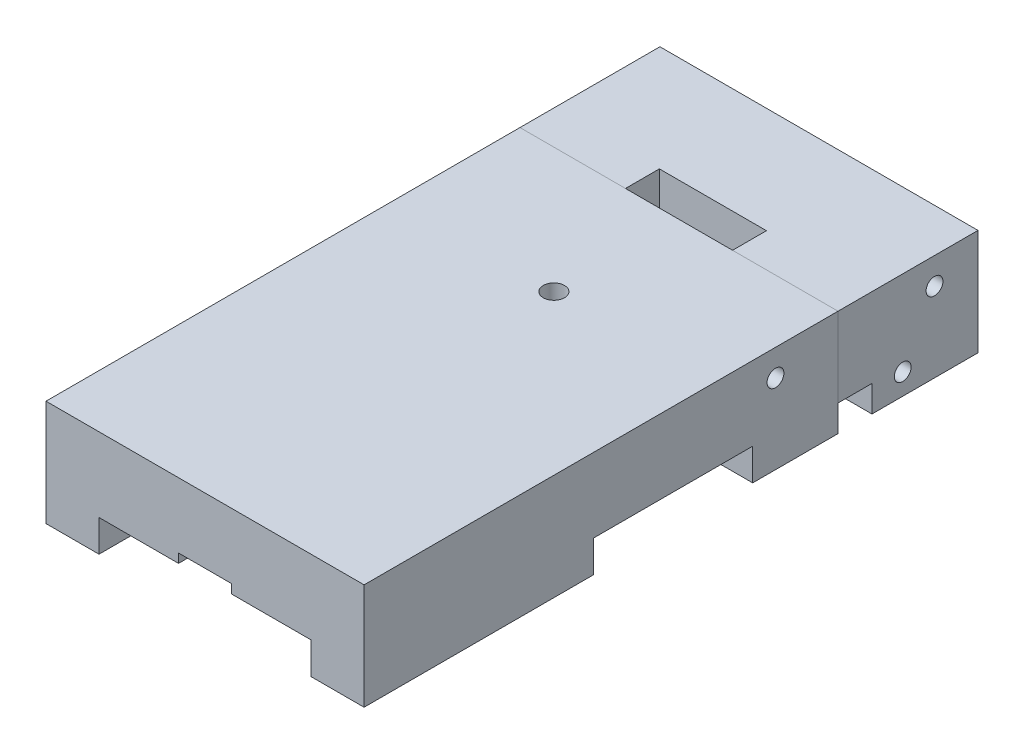
from build123d import *

# Parameters (mm, degrees)
BOSS_EXTRUDE1_DEPTH         = 12.7
BOSS_EXTRUDE1_DEPTH_BACK    = 12.7
SKETCH1_W                   = 76.2
SKETCH1_H                   = 147.066
SKETCH2_R                   = 4.7625
CUT_EXTRUDE1_DEPTH          = 25.4
CUT_EXTRUDE2_DEPTH          = 7.62
CUT_EXTRUDE4_DEPTH          = 84.785452729
CUT_EXTRUDE4_DEPTH_BACK     = 84.785452729
SKETCH5_W                   = 25.654
SKETCH5_H                   = 8.128
F_1_4_20_TAPPED_HOLE1_D     = 5.1054
F_1_4_20_TAPPED_HOLE1_DEPTH = 19.05
F_1_4_20_TAPPED_HOLE1_TIP   = 1.533816902
SKETCH9_R                   = 1.59639
F_8_32_TAPPED_HOLE_DEPTH    = 12.7
CUT_EXTRUDE7_DEPTH          = 2.159
SKETCH12_R                  = 2.0193
CUT_EXTRUDE8_DEPTH          = 12.7
SKETCH13_W                  = 25.273
SKETCH13_H                  = 8.128
CUT_EXTRUDE9_DEPTH          = 6.35
SKETCH15_R                  = 2.0193
CUT_EXTRUDE11_DEPTH         = 57.15
SKETCH17_R                  = 4.2164
CUT_EXTRUDE12_DEPTH         = 5.461
SKETCH19_R                  = 2.0193
CUT_EXTRUDE14_DEPTH         = 12.7
CUT_EXTRUDE16_DEPTH         = 2.286
CUT_EXTRUDE18_DEPTH         = 11.176
F_10_32_TAPPED_HOLE1_D      = 4.0386
F_10_32_TAPPED_HOLE1_DEPTH  = 14.1224
F_10_32_TAPPED_HOLE1_TIP    = 1.213317848


with BuildPart() as part:
    # Sketch1 → Boss-Extrude1 (new, two sides: drawn at the far end of the back side and taken through both)
    with BuildSketch(Plane(origin=(0, 0, 0), x_dir=(1, 0, 0), z_dir=(0, 1, 0)).offset(-BOSS_EXTRUDE1_DEPTH_BACK)):
        Rectangle(SKETCH1_W, SKETCH1_H)
    extrude(amount=BOSS_EXTRUDE1_DEPTH + BOSS_EXTRUDE1_DEPTH_BACK)

    # Sketch2 → Cut-Extrude1 (cut)
    with BuildSketch(Plane(origin=(0, 0, -73.533), x_dir=(-1, 0, 0), z_dir=(0, 0, -1))):
        with Locations((0, -12.7)):
            Circle(SKETCH2_R)
    extrude(amount=-CUT_EXTRUDE1_DEPTH, mode=Mode.SUBTRACT)

    # Sketch3 → Cut-Extrude2 (cut)
    with BuildSketch(Plane(origin=(0, -12.7, 0), x_dir=(-1, 0, 0), z_dir=(0, -1, 0))):
        with BuildLine():
            Line((10.922, 19.558), (44.45, 19.558))
            Line((44.45, 19.558), (44.45, -18.542))
            Line((44.45, -18.542), (25.4, -18.542))
            Line((25.4, -18.542), (25.4, -76.708))
            ThreePointArc((25.4, -76.708), (23.540128061, -81.198128061), (19.05, -83.058))
            Line((19.05, -83.058), (-19.05, -83.058))
            ThreePointArc((-19.05, -83.058), (-23.540128061, -81.198128061), (-25.4, -76.708))
            Line((-25.4, -76.708), (-25.4, -18.542))
            Line((-25.4, -18.542), (-44.45, -18.542))
            Line((-44.45, -18.542), (-44.45, 19.558))
            Line((-44.45, 19.558), (-10.922, 19.558))
            Line((-10.922, 19.558), (-10.922, 40.005))
            Line((-10.922, 40.005), (10.922, 40.005))
            Line((10.922, 40.005), (10.922, 19.558))
        make_face()
    extrude(amount=-CUT_EXTRUDE2_DEPTH, mode=Mode.SUBTRACT)

    # Sketch5 → Cut-Extrude4 (cut, two sides: drawn at the far end of the back side and taken through both)
    with BuildSketch(Plane(origin=(0, 0, 0), x_dir=(1, 0, 0), z_dir=(0, 1, 0)).offset(-CUT_EXTRUDE4_DEPTH_BACK)):
        with Locations((0, 44.069)):
            Rectangle(SKETCH5_W, SKETCH5_H)
    extrude(amount=CUT_EXTRUDE4_DEPTH + CUT_EXTRUDE4_DEPTH_BACK, mode=Mode.SUBTRACT)

    # 1/4-20 Tapped Hole1
    with Locations(Plane(origin=(-11.034450397, 12.7, 14.547513529), x_dir=(-1, 0, 0), z_dir=(0, 1, 0))):
        with Locations((-11.034450397, -24.580513529)):
            Hole(F_1_4_20_TAPPED_HOLE1_D / 2, depth=F_1_4_20_TAPPED_HOLE1_DEPTH)
            with Locations((0, 0, -(F_1_4_20_TAPPED_HOLE1_DEPTH + F_1_4_20_TAPPED_HOLE1_TIP / 2))):  # 118° drill point
                Cone(0, F_1_4_20_TAPPED_HOLE1_D / 2, F_1_4_20_TAPPED_HOLE1_TIP, mode=Mode.SUBTRACT)

    # Sketch9 → 8-32 Tapped Hole (cut)
    with BuildSketch(Plane(origin=(0, -12.7, 0), x_dir=(-1, 0, 0), z_dir=(0, -1, 0))):
        with Locations((31.75, 29.083)):
            Circle(SKETCH9_R)
        with Locations((31.75, -28.067)):
            Circle(SKETCH9_R)
        with Locations((-31.75, -28.067)):
            Circle(SKETCH9_R)
        with Locations((-31.75, 29.083)):
            Circle(SKETCH9_R)
    extrude(amount=-F_8_32_TAPPED_HOLE_DEPTH, mode=Mode.SUBTRACT)

    # Sketch11 → Cut-Extrude7 (cut)
    with BuildSketch(Plane(origin=(0, -5.08, 0), x_dir=(-1, 0, 0), z_dir=(0, -1, 0))):
        with BuildLine():
            Line((0.00254, -32.893), (-0.00254, -32.893))
            ThreePointArc((-0.00254, -32.893), (-4.490872009, -34.752127991), (-6.35, -39.24046))
            Line((-6.35, -39.24046), (-6.35, -73.533))
            Line((-6.35, -73.533), (6.35, -73.533))
            Line((6.35, -73.533), (6.35, -39.24046))
            ThreePointArc((6.35, -39.24046), (4.490872009, -34.752127991), (0.00254, -32.893))
        make_face()
    extrude(amount=-CUT_EXTRUDE7_DEPTH, mode=Mode.SUBTRACT)

    # Sketch12 → Cut-Extrude8 (cut)
    with BuildSketch(Plane.XZ.offset(5.08)):
        with Locations((12.7, 54.483)):
            Circle(SKETCH12_R)
        with Locations((-12.7, 54.483)):
            Circle(SKETCH12_R)
    extrude(amount=-CUT_EXTRUDE8_DEPTH, mode=Mode.SUBTRACT)

    # Sketch13 → Cut-Extrude9 (cut)
    with BuildSketch(Plane.XZ.offset(12.7)):
        with Locations((25.4635, -44.069)):
            Rectangle(SKETCH13_W, SKETCH13_H)
    extrude(amount=-CUT_EXTRUDE9_DEPTH, mode=Mode.SUBTRACT)

    # Sketch15 → Cut-Extrude11 (cut)
    with BuildSketch(Plane(origin=(0, 0, -73.533), x_dir=(-1, 0, 0), z_dir=(0, 0, -1))):
        with Locations((-24.13, 0)):
            Circle(SKETCH15_R)
        with Locations((24.13, 0)):
            Circle(SKETCH15_R)
    extrude(amount=-CUT_EXTRUDE11_DEPTH, mode=Mode.SUBTRACT)

    # Sketch17 → Cut-Extrude12 (cut)
    with BuildSketch(Plane(origin=(0, 0, -73.533), x_dir=(-1, 0, 0), z_dir=(0, 0, -1))):
        with Locations((-24.13, 0)):
            Circle(SKETCH17_R)
        with Locations((24.13, 0)):
            Circle(SKETCH17_R)
    extrude(amount=-CUT_EXTRUDE12_DEPTH, mode=Mode.SUBTRACT)

    # Sketch19 → Cut-Extrude14 (cut)
    with BuildSketch(Plane.XZ.offset(12.7)):
        with Locations((-31.75, -56.4388)):
            Circle(SKETCH19_R)
        with Locations((-12.7, -56.4388)):
            Circle(SKETCH19_R)
    extrude(amount=-CUT_EXTRUDE14_DEPTH, mode=Mode.SUBTRACT)

    # Sketch22 → Cut-Extrude16 (cut)
    with BuildSketch(Plane.XZ.offset(12.7)):
        with BuildLine():
            Line((-12.7, -33.36925), (12.7, -33.36925))
            ThreePointArc((12.7, -33.36925), (13.49375, -32.5755), (12.7, -31.78175))
            Line((12.7, -31.78175), (-12.7, -31.78175))
            ThreePointArc((-12.7, -31.78175), (-13.49375, -32.5755), (-12.7, -33.36925))
        make_face()
        with BuildLine():
            Line((-12.7, -21.11375), (12.7, -21.11375))
            ThreePointArc((12.7, -21.11375), (13.49375, -21.9075), (12.7, -22.70125))
            Line((12.7, -22.70125), (-12.7, -22.70125))
            ThreePointArc((-12.7, -22.70125), (-13.49375, -21.9075), (-12.7, -21.11375))
        make_face()
    extrude(amount=-CUT_EXTRUDE16_DEPTH, mode=Mode.SUBTRACT)

    # Sketch23 → Cut-Extrude18 (cut)
    with BuildSketch(Plane.XZ.offset(12.7)):
        with BuildLine():
            Line((-10.922, -40.005), (10.922, -40.005))
            Line((10.922, -40.005), (10.922, -22.733))
            ThreePointArc((10.922, -22.733), (9.99206403, -20.48793597), (7.747, -19.558))
            Line((7.747, -19.558), (-7.747, -19.558))
            ThreePointArc((-7.747, -19.558), (-9.99206403, -20.48793597), (-10.922, -22.733))
            Line((-10.922, -22.733), (-10.922, -40.005))
        make_face()
    extrude(amount=-CUT_EXTRUDE18_DEPTH, mode=Mode.SUBTRACT)

    # #10-32 Tapped Hole1
    with Locations(Plane(origin=(38.1, 0, 0), x_dir=(0, 0, -1), z_dir=(1, 0, 0))):
        with Locations((63.119, 6.35), (55.499, -7.62), (25.019, 6.35)):
            Hole(F_10_32_TAPPED_HOLE1_D / 2, depth=F_10_32_TAPPED_HOLE1_DEPTH)
            with Locations((0, 0, -(F_10_32_TAPPED_HOLE1_DEPTH + F_10_32_TAPPED_HOLE1_TIP / 2))):  # 118° drill point
                Cone(0, F_10_32_TAPPED_HOLE1_D / 2, F_10_32_TAPPED_HOLE1_TIP, mode=Mode.SUBTRACT)


with BuildPart() as body_2:
    # Split1: the piece on the far side of the plane
    add(part.part)
    split(bisect_by=Plane(origin=(0, 0, -40.005), x_dir=(-1, 0, 0), z_dir=(0, 0, -1)), keep=Keep.BOTTOM)


with BuildPart() as part_1:
    add(part.part)

    # Split1
    split(bisect_by=Plane(origin=(0, 0, -40.005), x_dir=(-1, 0, 0), z_dir=(0, 0, -1)), keep=Keep.TOP)


solid = Compound([body_2.part, part_1.part])
